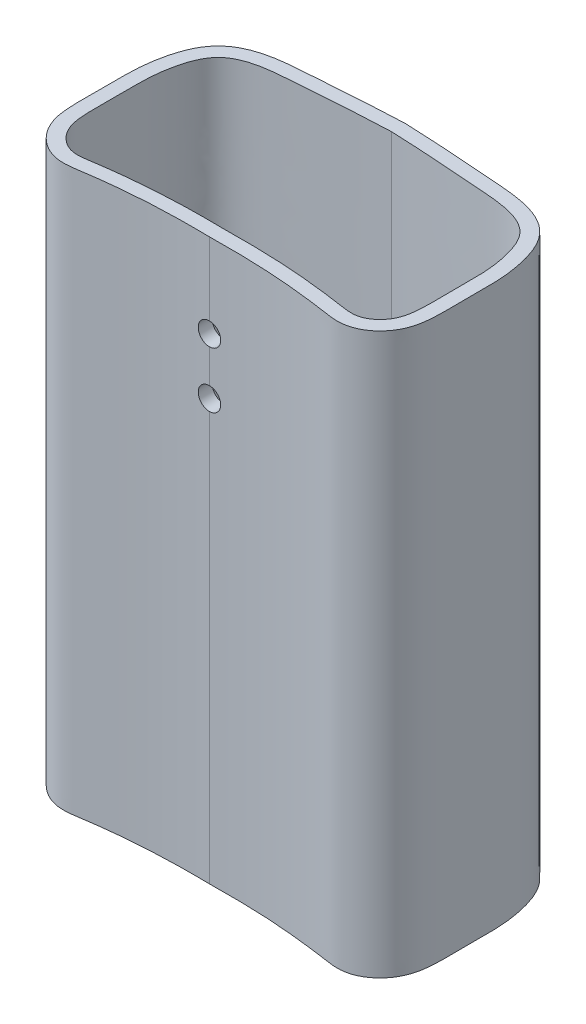
from build123d import *

# Parameters (mm, degrees)
Y_KSEKLIK_EKSTR_ZYON1_DEPTH = 100
IZIM3_R                     = 2
KES_EKSTR_ZYON1_DEPTH       = 10


with BuildPart() as part:
    # Çizim1 → Yükseklik-Ekstrüzyon1 (new body)
    with BuildSketch(Plane(origin=(0, 0, 0), x_dir=(1, 0, 0), z_dir=(0, 1, 0))):
        with BuildLine():
            add(Edge.make_bspline(
                [(0, 20.430615398), (-0.458039073, 20.413356528), (-1.382157912, 20.376439041), (-3.165010597, 20.294580902), (-5.330194562, 20.178044108), (-7.860330276, 20.019573397), (-10.373199982, 19.845954655), (-12.918217627, 19.6624339), (-15.537311552, 19.467380127), (-18.308620562, 19.284223396), (-21.320000844, 18.983698332), (-24.357285669, 18.342147013), (-26.818640656, 17.269074379), (-28.592694122, 15.892793251), (-30.120379024, 14.097925366), (-31.250950233, 11.596757577), (-32.003541789, 8.696435347), (-32.421412998, 5.87919464), (-32.544277168, 3.061029245), (-32.488285024, 0.425460377), (-32.515426682, -2.053170599), (-32.550554324, -4.260117673), (-32.520238928, -6.078365492), (-32.435751629, -7.960331046), (-32.140381086, -10.140328618), (-31.05439625, -12.425048181), (-29.866030033, -13.91003502), (-28.379317628, -15.123351219), (-26.876286519, -15.84153118), (-25.525910245, -16.1330436), (-24.277664807, -16.220443218), (-22.881995178, -16.098205205), (-21.540120604, -15.877802628), (-20.277199997, -15.695510545), (-19.008162042, -15.522917343), (-17.334712466, -15.315147092), (-15.259122949, -15.091786387), (-12.781923867, -14.8802963), (-9.474641538, -14.669202103), (-6.122324101, -14.559047687), (-2.678888489, -14.538112028), (-0.887033741, -14.556488295), (0, -14.571517507)],
                knots=[-0.001069926, -0.001069926, -0.001069926, -0.001069926, 0.014579367, 0.03022866, 0.061527246, 0.092825832, 0.124124418, 0.155423004, 0.18672159, 0.218020176, 0.249318762, 0.280617348, 0.311915934, 0.327565226, 0.343214519, 0.374513105, 0.405811691, 0.437110277, 0.468408863, 0.499707449, 0.531006035, 0.562304621, 0.577953914, 0.593603207, 0.624901793, 0.640551086, 0.656200379, 0.671849672, 0.687498965, 0.695323611, 0.703148257, 0.71879755, 0.734446843, 0.750096136, 0.765745429, 0.781394722, 0.812693308, 0.843991894, 0.87529048, 0.937887652, 0.969186238, 1.000484824, 1.000484824, 1.000484824, 1.000484824], degree=3))
            add(Edge.make_bspline(
                [(0, -14.571517507), (0.887033741, -14.556488295), (2.678888489, -14.538112028), (6.122324101, -14.559047687), (9.474641538, -14.669202103), (12.781923867, -14.8802963), (15.259122949, -15.091786387), (17.334712466, -15.315147092), (19.008162042, -15.522917343), (20.277199997, -15.695510545), (21.540120604, -15.877802628), (22.881995178, -16.098205205), (24.277664807, -16.220443218), (25.525910245, -16.1330436), (26.876286519, -15.84153118), (28.379317628, -15.123351219), (29.866030033, -13.91003502), (31.05439625, -12.425048181), (32.140381086, -10.140328618), (32.435751629, -7.960331046), (32.520238928, -6.078365492), (32.550554324, -4.260117673), (32.515426682, -2.053170599), (32.488285024, 0.425460377), (32.544277168, 3.061029245), (32.421412998, 5.87919464), (32.003541789, 8.696435347), (31.250950233, 11.596757577), (30.120379024, 14.097925366), (28.592694122, 15.892793251), (26.818640656, 17.269074379), (24.357285669, 18.342147013), (21.320000844, 18.983698332), (18.308620562, 19.284223396), (15.537311552, 19.467380127), (12.918217627, 19.6624339), (10.373199982, 19.845954655), (7.860330276, 20.019573397), (5.330194562, 20.178044108), (3.165010597, 20.294580902), (1.382157912, 20.376439041), (0.458039073, 20.413356528), (0, 20.430615398)],
                knots=[-0.001069926, -0.001069926, -0.001069926, -0.001069926, 0.03022866, 0.061527246, 0.124124418, 0.155423004, 0.18672159, 0.218020176, 0.233669469, 0.249318762, 0.264968055, 0.280617348, 0.296266641, 0.304091287, 0.311915934, 0.327565226, 0.343214519, 0.358863812, 0.374513105, 0.405811691, 0.421460984, 0.437110277, 0.468408863, 0.499707449, 0.531006035, 0.562304621, 0.593603207, 0.624901793, 0.656200379, 0.671849672, 0.687498965, 0.71879755, 0.750096136, 0.781394722, 0.812693308, 0.843991894, 0.87529048, 0.906589066, 0.937887652, 0.969186238, 0.984835531, 1.000484824, 1.000484824, 1.000484824, 1.000484824], degree=3))
        make_face()
        with BuildLine():
            add(Edge.make_bspline(
                [(0, 17.928841308), (-5.820212095, 17.709536244), (-13.903357487, 17.042587637), (-26.87571665, 16.196014495), (-29.550286899, 8.929250371), (-30.090469717, 4.336098712), (-29.940693307, -0.887353996), (-30.154927851, -5.701691423), (-29.637182829, -10.928766593), (-26.031174583, -14.081750554), (-15.720131404, -12.349312728), (-7.807226576, -11.938879102), (0, -12.071158692)],
                knots=[0, 0, 0, 0, 0.198459501, 0.336012796, 0.394476639, 0.459729731, 0.505376957, 0.582750838, 0.635932872, 0.690008906, 0.731880659, 1, 1, 1, 1], degree=3))
            add(Edge.make_bspline(
                [(0, 17.928841308), (5.820212095, 17.709536244), (13.903357487, 17.042587637), (26.87571665, 16.196014495), (29.550286899, 8.929250371), (30.090469717, 4.336098712), (29.940693307, -0.887353996), (30.154927851, -5.701691423), (29.637182829, -10.928766593), (26.031174583, -14.081750554), (15.720131404, -12.349312728), (7.807226576, -11.938879102), (0, -12.071158692)],
                knots=[0, 0, 0, 0, 0.198459501, 0.336012796, 0.394476639, 0.459729731, 0.505376957, 0.582750838, 0.635932872, 0.690008906, 0.731880659, 1, 1, 1, 1], degree=3))
        make_face(mode=Mode.SUBTRACT)
    extrude(amount=Y_KSEKLIK_EKSTR_ZYON1_DEPTH)

    # Çizim3 → Kes-Ekstrüzyon1 (cut)
    with BuildSketch(Plane(origin=(0, 0, 14.571517507), x_dir=(-1, 0, 0), z_dir=(0, 0, -1))):
        with Locations((0, 85)):
            Circle(IZIM3_R)
        with Locations((0, 75)):
            Circle(IZIM3_R)
    extrude(amount=KES_EKSTR_ZYON1_DEPTH, mode=Mode.SUBTRACT)


solid = part.part
